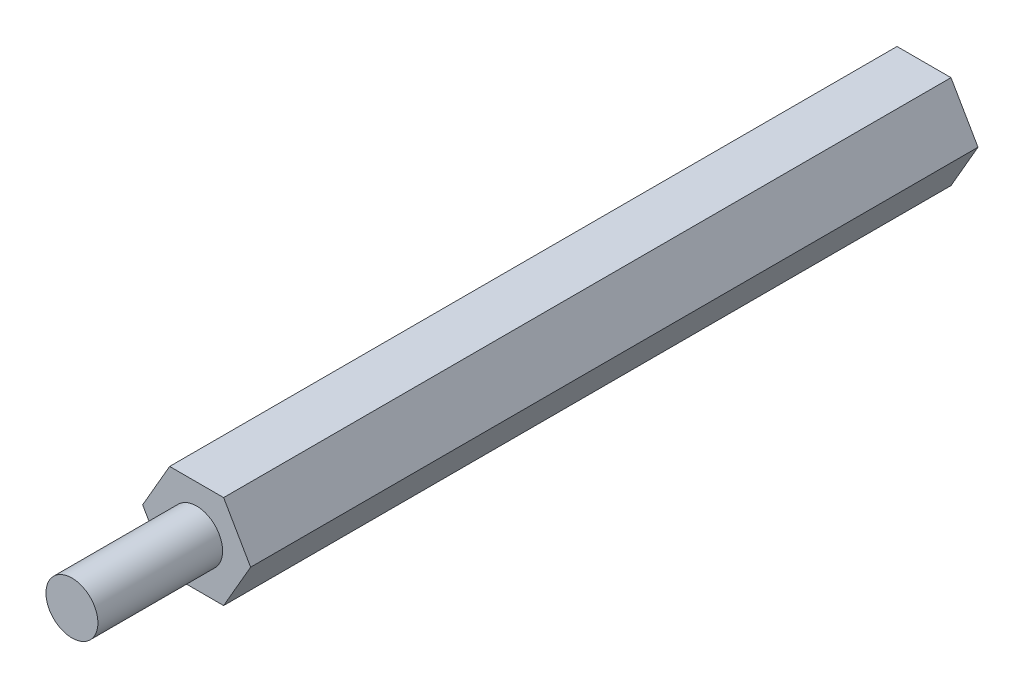
from build123d import *

# Parameters (mm, degrees)
EXTRUDE_1_DEPTH = 35
SKETCH_2_R      = 1.25
EXTRUDE_2_DEPTH = 6


# Read off the part's stored shape, not the designer's step: M3 螺纹孔1
with BuildPart() as part:
    # 草图1 → 凸台-拉伸1 (new body)
    with BuildSketch(Plane.XY):
        Polygon((2.598076211, 0), (1.299038106, 2.25), (-1.299038106, 2.25), (-2.598076211, 0), (-1.299038106, -2.25), (1.299038106, -2.25), align=None)
    extrude(amount=EXTRUDE_1_DEPTH)

    # 草图2 → 凸台-拉伸2 (add)
    with BuildSketch(Plane.XY.offset(35)):
        Circle(SKETCH_2_R)
    extrude(amount=EXTRUDE_2_DEPTH)

    # M3 螺纹孔1 outline → M3 螺纹孔1 (revolve, cut)
    with BuildSketch(Plane.XZ):
        Polygon((1.25, 7.5), (0, 8.251075774), (0, 0), (1.25, 0), align=None)
    revolve(axis=Axis((0, 0, 0), (0, 0, 1)), mode=Mode.SUBTRACT)


solid = part.part
